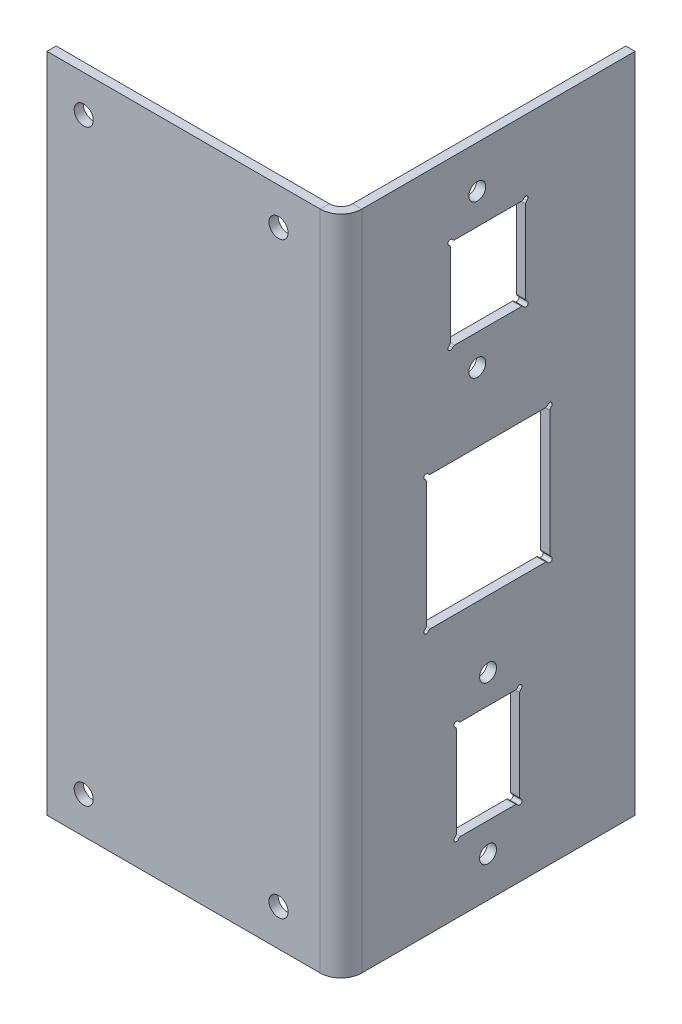
from build123d import *
from build123d.topology import SkipClean

# Parameters (mm, degrees)
BOSS_EXTRUDE1_DEPTH        = 114.3
SKETCH3_R                  = 1.651
CUT_EXTRUDE2_DEPTH         = 135.530111499
SKETCH5_R                  = 1.4605
CUT_EXTRUDE3_DEPTH         = 136.002851822
CONVERT_SOLID2_START       = 49.2125
CONVERT_SOLID2_OUTLINE_W   = 114.3
CONVERT_SOLID2_OUTLINE_H   = 49.53
CONVERT_SOLID2_OUTLINE_R   = 1.4605
CONVERT_SOLID2_DEPTH       = 0.3175
CONVERT_SOLID2_START_2     = 8.000755338
CONVERT_SOLID2_2_OUTLINE_W = 114.3
CONVERT_SOLID2_2_OUTLINE_H = 0.3175
CONVERT_SOLID2_2_DEPTH     = 30.652049453
CONVERT_SOLID2_START_3     = 41.655755338
CONVERT_SOLID2_3_OUTLINE_W = 114.3
CONVERT_SOLID2_3_OUTLINE_H = 0.3175
CONVERT_SOLID2_3_DEPTH     = 7.556744662
CONVERT_SOLID2_4_OUTLINE_W = 114.3
CONVERT_SOLID2_4_OUTLINE_H = 0.3175
CONVERT_SOLID2_4_DEPTH     = 4.997804791
CONVERT_SOLID2_START_4     = -1.5875
CONVERT_SOLID2_5_DEPTH     = 0.3175
CONVERT_SOLID2_6_DEPTH     = 0.3175
CONVERT_SOLID2_7_DEPTH     = 114.3
CONVERT_SOLID2_8_DEPTH     = 114.3


with BuildPart() as part:
    # Sketch1 → Boss-Extrude1 (new body)
    with BuildSketch(Plane(origin=(0, 0, 0), x_dir=(1, 0, 0), z_dir=(0, 1, 0))):
        Polygon((0, 0), (0, 1.27), (49.53, 1.27), (49.53, 50.8), (50.8, 50.8), (50.8, 0), align=None)
    extrude(amount=BOSS_EXTRUDE1_DEPTH)

    # Sketch3 → Cut-Extrude2 (cut, through all)
    with BuildSketch(Plane(origin=(0, 0, -1.27), x_dir=(-1, 0, 0), z_dir=(0, 0, -1))):
        with Locations((-6.35, 107.95)):
            Circle(SKETCH3_R)
        with Locations((-6.35, 6.35)):
            Circle(SKETCH3_R)
        with Locations((-40.005, 6.35)):
            Circle(SKETCH3_R)
        with Locations((-40.005, 107.95)):
            Circle(SKETCH3_R)
    extrude(amount=-CUT_EXTRUDE2_DEPTH, mode=Mode.SUBTRACT)

    # Sketch5 → Cut-Extrude3 (cut, through all)
    with BuildSketch(Plane(origin=(50.8, 0, 0), x_dir=(0, 0, -1), z_dir=(1, 0, 0))):
        with Locations((25.4, 6.9215)):
            Circle(SKETCH5_R)
        with Locations((25.4, 34.0741)):
            Circle(SKETCH5_R)
        with Locations((23.5458, 80.6196)):
            Circle(SKETCH5_R)
        with Locations((23.5458, 106.9848)):
            Circle(SKETCH5_R)
        with BuildLine():
            Line((31.9024, 86.664321593), (31.9024, 100.940078407))
            ThreePointArc((31.9024, 100.940078407), (31.959339203, 101.152578407), (32.1149, 101.308139203))
            ThreePointArc((32.1149, 101.308139203), (32.202920382, 101.976720382), (31.534339203, 101.8887))
            ThreePointArc((31.534339203, 101.8887), (31.378778407, 101.733139203), (31.166278407, 101.6762))
            Line((31.166278407, 101.6762), (19.633721593, 101.6762))
            ThreePointArc((19.633721593, 101.6762), (19.421221593, 101.733139203), (19.265660797, 101.8887))
            ThreePointArc((19.265660797, 101.8887), (18.597079618, 101.976720382), (18.6851, 101.308139203))
            ThreePointArc((18.6851, 101.308139203), (18.840660797, 101.152578407), (18.8976, 100.940078407))
            Line((18.8976, 100.940078407), (18.8976, 86.664321593))
            ThreePointArc((18.8976, 86.664321593), (18.840660797, 86.451821593), (18.6851, 86.296260797))
            ThreePointArc((18.6851, 86.296260797), (18.597079618, 85.627679618), (19.265660797, 85.7157))
            ThreePointArc((19.265660797, 85.7157), (19.421221593, 85.871260797), (19.633721593, 85.9282))
            Line((19.633721593, 85.9282), (31.166278407, 85.9282))
            ThreePointArc((31.166278407, 85.9282), (31.378778407, 85.871260797), (31.534339203, 85.7157))
            ThreePointArc((31.534339203, 85.7157), (32.202920382, 85.627679618), (32.1149, 86.296260797))
            ThreePointArc((32.1149, 86.296260797), (31.959339203, 86.451821593), (31.9024, 86.664321593))
        make_face()
        with BuildLine():
            Line((19.9263, 28.334178407), (19.9263, 12.661421593))
            ThreePointArc((19.9263, 12.661421593), (19.869360797, 12.448921593), (19.7138, 12.293360797))
            ThreePointArc((19.7138, 12.293360797), (19.625779618, 11.624779618), (20.294360797, 11.7128))
            ThreePointArc((20.294360797, 11.7128), (20.449921593, 11.868360797), (20.662421593, 11.9253))
            Line((20.662421593, 11.9253), (30.137578407, 11.9253))
            ThreePointArc((30.137578407, 11.9253), (30.350078407, 11.868360797), (30.505639203, 11.7128))
            ThreePointArc((30.505639203, 11.7128), (31.174220382, 11.624779618), (31.0862, 12.293360797))
            ThreePointArc((31.0862, 12.293360797), (30.930639203, 12.448921593), (30.8737, 12.661421593))
            Line((30.8737, 12.661421593), (30.8737, 28.334178407))
            ThreePointArc((30.8737, 28.334178407), (30.930639203, 28.546678407), (31.0862, 28.702239203))
            ThreePointArc((31.0862, 28.702239203), (31.174220382, 29.370820382), (30.505639203, 29.2828))
            ThreePointArc((30.505639203, 29.2828), (30.350078407, 29.127239203), (30.137578407, 29.0703))
            Line((30.137578407, 29.0703), (20.662421593, 29.0703))
            ThreePointArc((20.662421593, 29.0703), (20.449921593, 29.127239203), (20.294360797, 29.2828))
            ThreePointArc((20.294360797, 29.2828), (19.625779618, 29.370820382), (19.7138, 28.702239203))
            ThreePointArc((19.7138, 28.702239203), (19.869360797, 28.546678407), (19.9263, 28.334178407))
        make_face()
        with BuildLine():
            Line((14.732, 67.970878407), (14.732, 46.329121593))
            ThreePointArc((14.732, 46.329121593), (14.675060797, 46.116621593), (14.5195, 45.961060797))
            ThreePointArc((14.5195, 45.961060797), (14.431479618, 45.292479618), (15.100060797, 45.3805))
            ThreePointArc((15.100060797, 45.3805), (15.255621593, 45.536060797), (15.468121593, 45.593))
            Line((15.468121593, 45.593), (35.331878407, 45.593))
            ThreePointArc((35.331878407, 45.593), (35.544378407, 45.536060797), (35.699939203, 45.3805))
            ThreePointArc((35.699939203, 45.3805), (36.368520382, 45.292479618), (36.2805, 45.961060797))
            ThreePointArc((36.2805, 45.961060797), (36.124939203, 46.116621593), (36.068, 46.329121593))
            Line((36.068, 46.329121593), (36.068, 67.970878407))
            ThreePointArc((36.068, 67.970878407), (36.124939203, 68.183378407), (36.2805, 68.338939203))
            ThreePointArc((36.2805, 68.338939203), (36.368520382, 69.007520382), (35.699939203, 68.9195))
            ThreePointArc((35.699939203, 68.9195), (35.544378407, 68.763939203), (35.331878407, 68.707))
            Line((35.331878407, 68.707), (15.468121593, 68.707))
            ThreePointArc((15.468121593, 68.707), (15.255621593, 68.763939203), (15.100060797, 68.9195))
            ThreePointArc((15.100060797, 68.9195), (14.431479618, 69.007520382), (14.5195, 68.338939203))
            ThreePointArc((14.5195, 68.338939203), (14.675060797, 68.183378407), (14.732, 67.970878407))
        make_face()
    extrude(amount=-CUT_EXTRUDE3_DEPTH, mode=Mode.SUBTRACT)

    # Convert-Solid2: read off the stored shape, not the designer's step
    # Convert-Solid2 outline → Convert-Solid2 (add)
    with SkipClean():  # the faces are left unmerged after this step: merging them gives an invalid solid
        with BuildSketch(Plane.YZ.offset(CONVERT_SOLID2_START)):
            with Locations((57.15, -26.035)):
                Rectangle(CONVERT_SOLID2_OUTLINE_W, CONVERT_SOLID2_OUTLINE_H)
            with Locations((6.9215, -25.4)):
                Circle(CONVERT_SOLID2_OUTLINE_R, mode=Mode.SUBTRACT)
            with BuildLine():
                ThreePointArc((28.702239203, -31.0862), (28.546678407, -30.930639203), (28.334178407, -30.8737))
                Line((28.334178407, -30.8737), (12.661421593, -30.8737))
                ThreePointArc((12.661421593, -30.8737), (12.448921593, -30.930639203), (12.293360797, -31.0862))
                ThreePointArc((12.293360797, -31.0862), (11.624779618, -31.174220382), (11.7128, -30.505639203))
                ThreePointArc((11.7128, -30.505639203), (11.868360797, -30.350078407), (11.9253, -30.137578407))
                Line((11.9253, -30.137578407), (11.9253, -20.662421593))
                ThreePointArc((11.9253, -20.662421593), (11.868360797, -20.449921593), (11.7128, -20.294360797))
                ThreePointArc((11.7128, -20.294360797), (11.624779618, -19.625779618), (12.293360797, -19.7138))
                ThreePointArc((12.293360797, -19.7138), (12.448921593, -19.869360797), (12.661421593, -19.9263))
                Line((12.661421593, -19.9263), (28.334178407, -19.9263))
                ThreePointArc((28.334178407, -19.9263), (28.546678407, -19.869360797), (28.702239203, -19.7138))
                ThreePointArc((28.702239203, -19.7138), (29.370820382, -19.625779618), (29.2828, -20.294360797))
                ThreePointArc((29.2828, -20.294360797), (29.127239203, -20.449921593), (29.0703, -20.662421593))
                Line((29.0703, -20.662421593), (29.0703, -30.137578407))
                ThreePointArc((29.0703, -30.137578407), (29.127239203, -30.350078407), (29.2828, -30.505639203))
                ThreePointArc((29.2828, -30.505639203), (29.370820382, -31.174220382), (28.702239203, -31.0862))
            make_face(mode=Mode.SUBTRACT)
            with Locations((34.0741, -25.4)):
                Circle(CONVERT_SOLID2_OUTLINE_R, mode=Mode.SUBTRACT)
            with BuildLine():
                ThreePointArc((68.9195, -35.699939203), (69.007520382, -36.368520382), (68.338939203, -36.2805))
                ThreePointArc((68.338939203, -36.2805), (68.183378407, -36.124939203), (67.970878407, -36.068))
                Line((67.970878407, -36.068), (46.329121593, -36.068))
                ThreePointArc((46.329121593, -36.068), (46.116621593, -36.124939203), (45.961060797, -36.2805))
                ThreePointArc((45.961060797, -36.2805), (45.292479618, -36.368520382), (45.3805, -35.699939203))
                ThreePointArc((45.3805, -35.699939203), (45.536060797, -35.544378407), (45.593, -35.331878407))
                Line((45.593, -35.331878407), (45.593, -15.468121593))
                ThreePointArc((45.593, -15.468121593), (45.536060797, -15.255621593), (45.3805, -15.100060797))
                ThreePointArc((45.3805, -15.100060797), (45.292479618, -14.431479618), (45.961060797, -14.5195))
                ThreePointArc((45.961060797, -14.5195), (46.116621593, -14.675060797), (46.329121593, -14.732))
                Line((46.329121593, -14.732), (67.970878407, -14.732))
                ThreePointArc((67.970878407, -14.732), (68.183378407, -14.675060797), (68.338939203, -14.5195))
                ThreePointArc((68.338939203, -14.5195), (69.007520382, -14.431479618), (68.9195, -15.100060797))
                ThreePointArc((68.9195, -15.100060797), (68.763939203, -15.255621593), (68.707, -15.468121593))
                Line((68.707, -15.468121593), (68.707, -35.331878407))
                ThreePointArc((68.707, -35.331878407), (68.763939203, -35.544378407), (68.9195, -35.699939203))
            make_face(mode=Mode.SUBTRACT)
            with Locations((80.6196, -23.5458)):
                Circle(CONVERT_SOLID2_OUTLINE_R, mode=Mode.SUBTRACT)
            with BuildLine():
                ThreePointArc((101.308139203, -32.1149), (101.152578407, -31.959339203), (100.940078407, -31.9024))
                Line((100.940078407, -31.9024), (86.664321593, -31.9024))
                ThreePointArc((86.664321593, -31.9024), (86.451821593, -31.959339203), (86.296260797, -32.1149))
                ThreePointArc((86.296260797, -32.1149), (85.627679618, -32.202920382), (85.7157, -31.534339203))
                ThreePointArc((85.7157, -31.534339203), (85.871260797, -31.378778407), (85.9282, -31.166278407))
                Line((85.9282, -31.166278407), (85.9282, -19.633721593))
                ThreePointArc((85.9282, -19.633721593), (85.871260797, -19.421221593), (85.7157, -19.265660797))
                ThreePointArc((85.7157, -19.265660797), (85.627679618, -18.597079618), (86.296260797, -18.6851))
                ThreePointArc((86.296260797, -18.6851), (86.451821593, -18.840660797), (86.664321593, -18.8976))
                Line((86.664321593, -18.8976), (100.940078407, -18.8976))
                ThreePointArc((100.940078407, -18.8976), (101.152578407, -18.840660797), (101.308139203, -18.6851))
                ThreePointArc((101.308139203, -18.6851), (101.976720382, -18.597079618), (101.8887, -19.265660797))
                ThreePointArc((101.8887, -19.265660797), (101.733139203, -19.421221593), (101.6762, -19.633721593))
                Line((101.6762, -19.633721593), (101.6762, -31.166278407))
                ThreePointArc((101.6762, -31.166278407), (101.733139203, -31.378778407), (101.8887, -31.534339203))
                ThreePointArc((101.8887, -31.534339203), (101.976720382, -32.202920382), (101.308139203, -32.1149))
            make_face(mode=Mode.SUBTRACT)
            with Locations((106.9848, -23.5458)):
                Circle(CONVERT_SOLID2_OUTLINE_R, mode=Mode.SUBTRACT)
        extrude(amount=CONVERT_SOLID2_DEPTH)

    # Convert-Solid2 2 outline → Convert-Solid2 2 (add)
    with SkipClean():  # the faces are left unmerged after this step: merging them gives an invalid solid
        with BuildSketch(Plane.YZ.offset(CONVERT_SOLID2_START_2)):
            with Locations((57.15, -1.42875)):
                Rectangle(CONVERT_SOLID2_2_OUTLINE_W, CONVERT_SOLID2_2_OUTLINE_H)
        extrude(amount=CONVERT_SOLID2_2_DEPTH)

    # Convert-Solid2 3 outline → Convert-Solid2 3 (add)
    with SkipClean():  # the faces are left unmerged after this step: merging them gives an invalid solid
        with BuildSketch(Plane.YZ.offset(CONVERT_SOLID2_START_3)):
            with Locations((57.15, -1.42875)):
                Rectangle(CONVERT_SOLID2_3_OUTLINE_W, CONVERT_SOLID2_3_OUTLINE_H)
        extrude(amount=CONVERT_SOLID2_3_DEPTH)

    # Convert-Solid2 4 outline → Convert-Solid2 4 (add)
    with SkipClean():  # the faces are left unmerged after this step: merging them gives an invalid solid
        with BuildSketch(Plane.YZ):
            with Locations((57.15, -1.42875)):
                Rectangle(CONVERT_SOLID2_4_OUTLINE_W, CONVERT_SOLID2_4_OUTLINE_H)
        extrude(amount=CONVERT_SOLID2_4_DEPTH)

    # Convert-Solid2 5 outline → Convert-Solid2 5 (cut)
    with SkipClean():  # the faces are left unmerged after this step: merging them gives an invalid solid
        with BuildSketch(Plane.XY.offset(CONVERT_SOLID2_START_4)):
            with BuildLine():
                ThreePointArc((8.000755338, 6.32157793), (8.001, 6.35), (8.000755338, 6.37842207))
                Line((8.000755338, 6.37842207), (8.000755338, 6.32157793))
            make_face()
            with BuildLine():
                Line((4.997804791, 5.402704314), (4.997804791, 7.297295686))
                ThreePointArc((4.997804791, 7.297295686), (4.699, 6.35), (4.997804791, 5.402704314))
            make_face()
            with BuildLine():
                Line((8.000755338, 107.97842207), (8.000755338, 107.92157793))
                ThreePointArc((8.000755338, 107.92157793), (8.001, 107.95), (8.000755338, 107.97842207))
            make_face()
            with BuildLine():
                ThreePointArc((4.997804791, 108.897295686), (4.699, 107.95), (4.997804791, 107.002704314))
                Line((4.997804791, 107.002704314), (4.997804791, 108.897295686))
            make_face()
            with BuildLine():
                ThreePointArc((38.652804791, 7.297295686), (38.354, 6.35), (38.652804791, 5.402704314))
                Line((38.652804791, 5.402704314), (38.652804791, 7.297295686))
            make_face()
            with BuildLine():
                Line((41.655755338, 6.37842207), (41.655755338, 6.32157793))
                ThreePointArc((41.655755338, 6.32157793), (41.656, 6.35), (41.655755338, 6.37842207))
            make_face()
            with BuildLine():
                Line((38.652804791, 107.002704314), (38.652804791, 108.897295686))
                ThreePointArc((38.652804791, 108.897295686), (38.354, 107.95), (38.652804791, 107.002704314))
            make_face()
            with BuildLine():
                ThreePointArc((41.655755338, 107.92157793), (41.656, 107.95), (41.655755338, 107.97842207))
                Line((41.655755338, 107.97842207), (41.655755338, 107.92157793))
            make_face()
        extrude(amount=CONVERT_SOLID2_5_DEPTH, mode=Mode.SUBTRACT)

    # Convert-Solid2 6 outline → Convert-Solid2 6 (add)
    with SkipClean():  # the faces are left unmerged after this step: merging them gives an invalid solid
        with BuildSketch(Plane.XY.offset(CONVERT_SOLID2_START_4)):
            with BuildLine():
                ThreePointArc((4.997804791, 7.297295686), (6.833080447, 7.928744527), (8.000755338, 6.37842207))
                Line((8.000755338, 6.37842207), (8.000755338, 107.92157793))
                ThreePointArc((8.000755338, 107.92157793), (6.833080447, 106.371255473), (4.997804791, 107.002704314))
                Line((4.997804791, 107.002704314), (4.997804791, 7.297295686))
            make_face()
            with BuildLine():
                Line((8.000755338, 0), (8.000755338, 6.32157793))
                ThreePointArc((8.000755338, 6.32157793), (6.833080447, 4.771255473), (4.997804791, 5.402704314))
                Line((4.997804791, 5.402704314), (4.997804791, 0))
                Line((4.997804791, 0), (8.000755338, 0))
            make_face()
            with BuildLine():
                ThreePointArc((4.997804791, 108.897295686), (6.833080447, 109.528744527), (8.000755338, 107.97842207))
                Line((8.000755338, 107.97842207), (8.000755338, 114.3))
                Line((8.000755338, 114.3), (4.997804791, 114.3))
                Line((4.997804791, 114.3), (4.997804791, 108.897295686))
            make_face()
            with BuildLine():
                Line((38.652804791, 5.402704314), (38.652804791, 0))
                Line((38.652804791, 0), (41.655755338, 0))
                Line((41.655755338, 0), (41.655755338, 6.32157793))
                ThreePointArc((41.655755338, 6.32157793), (40.488080447, 4.771255473), (38.652804791, 5.402704314))
            make_face()
            with BuildLine():
                Line((41.655755338, 114.3), (38.652804791, 114.3))
                Line((38.652804791, 114.3), (38.652804791, 108.897295686))
                ThreePointArc((38.652804791, 108.897295686), (40.488080447, 109.528744527), (41.655755338, 107.97842207))
                Line((41.655755338, 107.97842207), (41.655755338, 114.3))
            make_face()
            with BuildLine():
                Line((38.652804791, 107.002704314), (38.652804791, 7.297295686))
                ThreePointArc((38.652804791, 7.297295686), (40.488080447, 7.928744527), (41.655755338, 6.37842207))
                Line((41.655755338, 6.37842207), (41.655755338, 107.92157793))
                ThreePointArc((41.655755338, 107.92157793), (40.488080447, 106.371255473), (38.652804791, 107.002704314))
            make_face()
        extrude(amount=CONVERT_SOLID2_6_DEPTH)

    # Convert-Solid2 7 outline → Convert-Solid2 7 (cut)
    with SkipClean():  # the faces are left unmerged after this step: merging them gives an invalid solid
        with BuildSketch(Plane(origin=(0, 0, 0), x_dir=(1, 0, 0), z_dir=(0, 1, 0))):
            with BuildLine():
                Line((50.8, 0), (50.8, 3.5875))
                ThreePointArc((50.8, 3.5875), (49.749245578, 1.050754422), (47.2125, 0))
                Line((47.2125, 0), (50.8, 0))
            make_face()
        extrude(amount=CONVERT_SOLID2_7_DEPTH, mode=Mode.SUBTRACT)

    # Convert-Solid2 8 outline → Convert-Solid2 8 (add)
    with SkipClean():  # the faces are left unmerged after this step: merging them gives an invalid solid
        with BuildSketch(Plane(origin=(0, 0, 0), x_dir=(1, 0, 0), z_dir=(0, 1, 0))):
            with BuildLine():
                Line((49.2125, 1.5875), (49.2125, 3.5875))
                ThreePointArc((49.2125, 3.5875), (48.626713562, 2.173286438), (47.2125, 1.5875))
                Line((47.2125, 1.5875), (49.2125, 1.5875))
            make_face()
        extrude(amount=CONVERT_SOLID2_8_DEPTH)


solid = part.part
